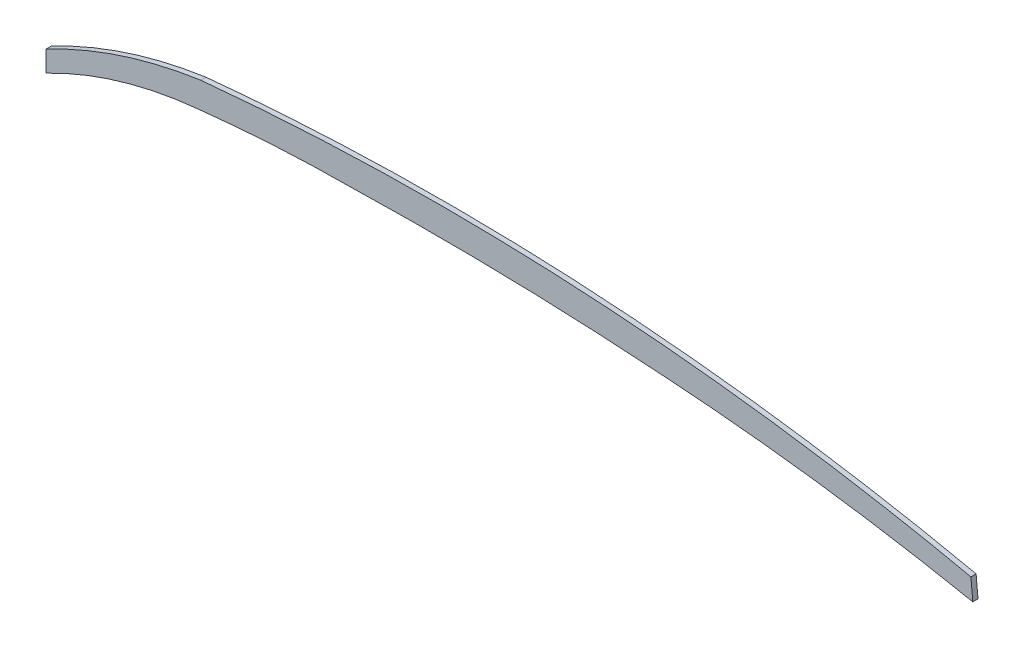
from build123d import *

# Parameters (mm, degrees)
BOSS_EXTRUDE1_DEPTH = 1.5875


with BuildPart() as part:
    # Sketch1 → Boss-Extrude1 (new, symmetric)
    with BuildSketch(Plane.XY):
        with BuildLine():
            Line((0, 98.649963947), (0, 85.942195343))
            ThreePointArc((0, 85.942195343), (44.883725347, 104.075489893), (92.3925, 113.364273632))
            ThreePointArc((92.3925, 113.364273632), (139.073495573, 117.280009783), (185.895946704, 118.731356536))
            ThreePointArc((185.895946704, 118.731356536), (279.546572247, 118.926979108), (373.101055052, 114.680017829))
            ThreePointArc((373.101055052, 114.680017829), (470.024153779, 105.277481614), (566.085246422, 89.316239979))
            Line((566.085246422, 89.316239979), (564.932089986, 101.967188211))
            add(Edge.make_bspline(
                [(564.932089986, 101.967188211), (526.305455218, 110.358765648), (487.405693808, 117.234573225), (438.439550099, 123.934433666), (428.624759847, 125.179975832), (408.998984047, 127.476532586), (399.18472115, 128.528085596), (369.737829992, 131.394153114), (350.101100844, 132.920187183), (291.174630327, 136.352842591), (251.868630305, 137.115735014), (173.213311456, 135.594221207), (133.863993721, 133.309891798), (94.492645692, 129.475822378)],
                knots=[0, 0, 0, 0, 0.25, 0.25, 0.3125, 0.3125, 0.375, 0.375, 0.5, 0.5, 0.75, 0.75, 1, 1, 1, 1], degree=3))
            ThreePointArc((94.492645692, 129.475822378), (45.925545315, 118.111564298), (0, 98.649963947))
        make_face()
    extrude(amount=BOSS_EXTRUDE1_DEPTH, both=True)


solid = part.part
